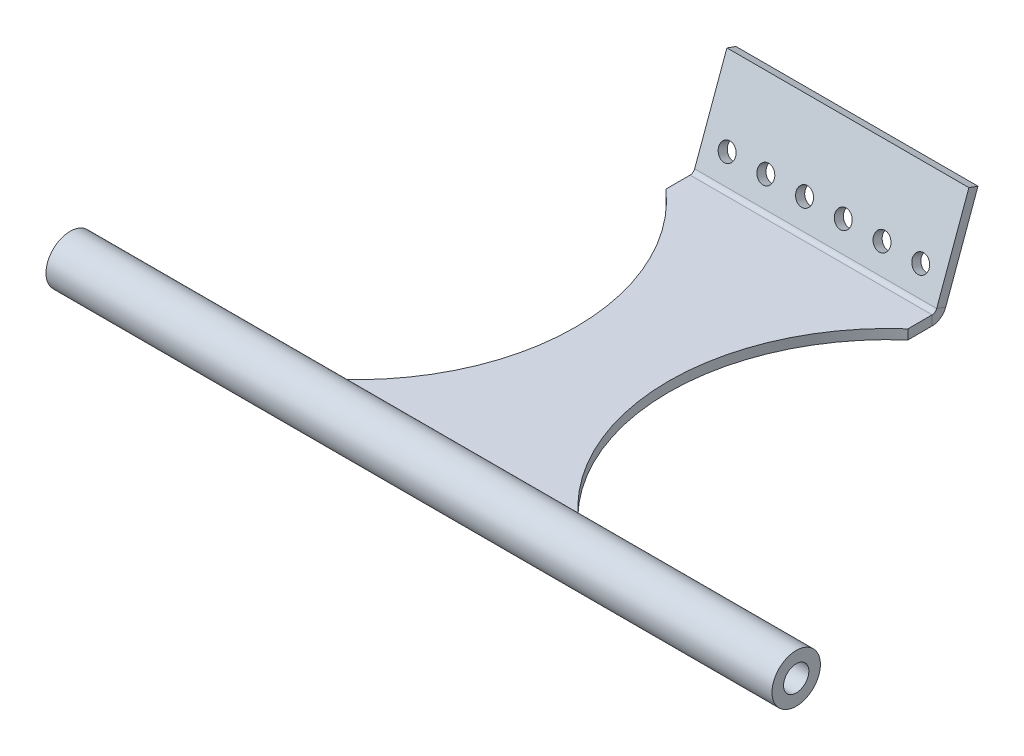
from build123d import *

# Parameters (mm, degrees)
SKETCH1_W                = 50
SKETCH1_H                = 100
BASE_FLANGE1_DEPTH       = 2
SKETCHED_START           = -25
SKETCHED_BEND1_DEPTH     = 50
SKETCHED_BEND1_2_DEPTH   = 50
CUT_EXTRUDE2_DEPTH       = 60.702826072
BOSS_EXTRUDE2_DEPTH      = 75
BOSS_EXTRUDE2_DEPTH_BACK = 75
SKETCH9_R                = 5
SKETCH10_R               = 1.75
CUT_EXTRUDE3_DEPTH       = 116.029027735
SKETCH11_R               = 2.61136214
CUT_EXTRUDE4_DEPTH       = 161.886846393


# Read off the part's stored shape, not the designer's step: Sketched Bend1
# Sheet-metal steps are written as plain solids
with BuildPart() as part:
    # Sketch1 → Base-Flange1 (new body)
    with BuildSketch(Plane(origin=(0, 0, 0), x_dir=(1, 0, 0), z_dir=(0, 1, 0))):
        Rectangle(SKETCH1_W, SKETCH1_H)
    extrude(amount=-BASE_FLANGE1_DEPTH)

    # Sketched Bend1 outline → Sketched Bend1 (cut)
    with BuildSketch(Plane.YZ.offset(SKETCHED_START)):
        with BuildLine():
            Line((0, -50), (0, -30.905812394))
            Line((0, -30.905812394), (-0.02606043, -30.896327173))
            ThreePointArc((-0.02606043, -30.896327173), (-1.457456133, -29.79797862), (-2, -28.077249311))
            Line((-2, -28.077249311), (-2, -50))
            Line((-2, -50), (0, -50))
        make_face()
    extrude(amount=SKETCHED_BEND1_DEPTH, mode=Mode.SUBTRACT)

    # Sketched Bend1 2 outline → Sketched Bend1 2 (add)
    with BuildSketch(Plane.YZ.offset(SKETCHED_START)):
        with BuildLine():
            Line((0, -30.905812394), (18.278484393, -37.558636641))
            Line((18.278484393, -37.558636641), (18.96252468, -35.679251399))
            Line((18.96252468, -35.679251399), (0.657979857, -29.016941932))
            ThreePointArc((0.657979857, -29.016941932), (0.180847956, -28.650825747), (0, -28.077249311))
            Line((0, -28.077249311), (0, -30.905812394))
        make_face()
    extrude(amount=SKETCHED_BEND1_2_DEPTH)

    # Sketch8 → Cut-Extrude2 (cut, through all)
    with BuildSketch(Plane.XZ.offset(2)):
        with BuildLine():
            Line((-25, 45), (-25, -23.077249311))
            ThreePointArc((-25, -23.077249311), (-9.62789438, 10.961375345), (-25, 45))
        make_face()
        with BuildLine():
            Line((25, -23.077249311), (25, 45))
            ThreePointArc((25, 45), (9.62789438, 10.961375345), (25, -23.077249311))
        make_face()
    extrude(amount=-CUT_EXTRUDE2_DEPTH, mode=Mode.SUBTRACT)

    # Sketch9 → Boss-Extrude2 (add, two sides: drawn at the far end of the back side and taken through both)
    with BuildSketch(Plane(origin=(0, 0, 0), x_dir=(0, 0, -1), z_dir=(1, 0, 0)).offset(-BOSS_EXTRUDE2_DEPTH_BACK)):
        with Locations((-50, -1)):
            Circle(SKETCH9_R)
    extrude(amount=BOSS_EXTRUDE2_DEPTH + BOSS_EXTRUDE2_DEPTH_BACK)

    # Sketch10 → Cut-Extrude3 (cut, through all)
    with BuildSketch(Plane(origin=(0, -9.932936637, -27.290519119), x_dir=(-1, 0, 0), z_dir=(0, -0.34202014332566616, -0.9396926207859094))):
        with Locations(Location((-20, 15.542677454, 0), (0, 0, 90))):
            Circle(SKETCH10_R)
        with Locations(Location((-12, 15.542677454, 0), (0, 0, 90))):
            Circle(SKETCH10_R)
        with Locations(Location((-4, 15.542677454, 0), (0, 0, 90))):
            Circle(SKETCH10_R)
        with Locations(Location((4, 15.542677454, 0), (0, 0, 90))):
            Circle(SKETCH10_R)
        with Locations(Location((12, 15.542677454, 0), (0, 0, 90))):
            Circle(SKETCH10_R)
        with Locations(Location((20, 15.542677454, 0), (0, 0, 90))):
            Circle(SKETCH10_R)
    extrude(amount=-CUT_EXTRUDE3_DEPTH, mode=Mode.SUBTRACT)

    # Sketch11 → Cut-Extrude4 (cut, through all)
    with BuildSketch(Plane.ZY.offset(75)):
        with Locations((50, -1)):
            Circle(SKETCH11_R)
    extrude(amount=-CUT_EXTRUDE4_DEPTH, mode=Mode.SUBTRACT)


solid = part.part
